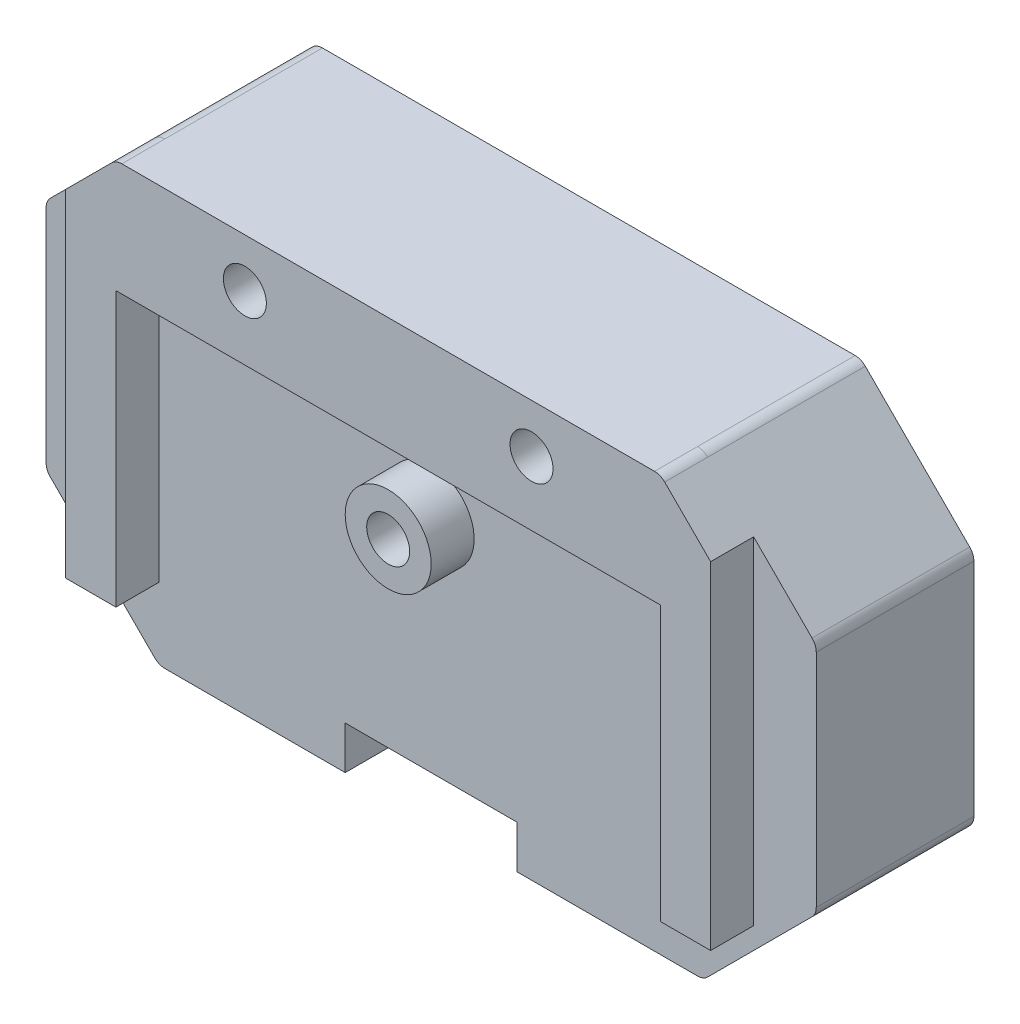
from build123d import *
from build123d.topology import SkipClean

# Parameters (mm, degrees)
CROQUIS3_W                   = 38
CROQUIS3_H                   = 38
SALIENTE_EXTRUIR9_DEPTH      = 1
SALIENTE_EXTRUIR10_START     = -11
SALIENTE_EXTRUIR10_OUTLINE_W = 38
SALIENTE_EXTRUIR10_OUTLINE_H = 38
SALIENTE_EXTRUIR10_DEPTH     = 10
CROQUIS13_W                  = 38
CROQUIS13_H                  = 38
SALIENTE_EXTRUIR15_DEPTH     = 3
CROQUIS14_R                  = 1.5
CORTAR_EXTRUIR1_DEPTH        = 14
CROQUIS15_W                  = 38
CROQUIS15_H                  = 24.129942315
CROQUIS15_R                  = 1.5
CROQUIS15_R_2                = 3.5
SALIENTE_EXTRUIR16_DEPTH     = 1
CORTAR_EXTRUIR2_DEPTH        = 14
CROQUIS17_R                  = 1.5
SALIENTE_EXTRUIR17_DEPTH     = 5
CROQUIS18_R                  = 1.5
CROQUIS18_W                  = 12
CROQUIS18_H                  = 12
SALIENTE_EXTRUIR18_DEPTH     = 5
CORTAR_EXTRUIR3_DEPTH        = 3
CROQUIS20_R                  = 3
CROQUIS20_R_2                = 1.5
SALIENTE_EXTRUIR19_DEPTH     = 3
REDONDEO11_R                 = 1


# Read off the part's stored shape, not the designer's step: Saliente-Extruir10
with BuildPart() as part:
    # Croquis3 → Saliente-Extruir9 (new body)
    with BuildSketch(Plane.XY.offset(5)):
        Polygon((19, -5.370057685), (26.870057685, 2.5), (26.870057685, 40.5), (19, 48.370057685), (-19, 48.370057685), (-26.870057685, 40.5), (-26.870057685, 2.5), (-19, -5.370057685), align=None)
        with Locations((0, 21.5)):
            Rectangle(CROQUIS3_W, CROQUIS3_H, mode=Mode.SUBTRACT)
    extrude(amount=-SALIENTE_EXTRUIR9_DEPTH)

    # Saliente-Extruir10 outline → Saliente-Extruir10 (add)
    with BuildSketch(Plane(origin=(0, 0, 4), x_dir=(-1, 0, 0), z_dir=(0, 0, -1)).offset(SALIENTE_EXTRUIR10_START)):
        Polygon((-26.870057685, 2.5), (-19, -5.370057685), (19, -5.370057685), (26.870057685, 2.5), (26.870057685, 40.5), (19, 48.370057685), (-19, 48.370057685), (-26.870057685, 40.5), align=None)
        with Locations((0, 21.5)):
            Rectangle(SALIENTE_EXTRUIR10_OUTLINE_W, SALIENTE_EXTRUIR10_OUTLINE_H, mode=Mode.SUBTRACT)
    extrude(amount=SALIENTE_EXTRUIR10_DEPTH)

    # Croquis13 → Saliente-Extruir15 (add)
    with BuildSketch(Plane.XY.offset(15)):
        with BuildLine():
            Line((-22.5, 44.870057685), (-22.5, -1))
            Line((-22.5, -1), (22.5, -1))
            Line((22.5, -1), (22.5, 44.870057685))
            Line((22.5, 44.870057685), (19.292893219, 48.077164466))
            ThreePointArc((19.292893219, 48.077164466), (18.96846987, 48.293937218), (18.585786438, 48.370057685))
            Line((18.585786438, 48.370057685), (-18.585786438, 48.370057685))
            ThreePointArc((-18.585786438, 48.370057685), (-18.96846987, 48.293937218), (-19.292893219, 48.077164466))
            Line((-19.292893219, 48.077164466), (-22.5, 44.870057685))
        make_face()
        with Locations((0, 21.5)):
            Rectangle(CROQUIS13_W, CROQUIS13_H, mode=Mode.SUBTRACT)
    extrude(amount=SALIENTE_EXTRUIR15_DEPTH)

    # Croquis14 → Cortar-Extruir1 (cut)
    with BuildSketch(Plane(origin=(0, 0, 4), x_dir=(-1, 0, 0), z_dir=(0, 0, -1))):
        with Locations((10, 44.97415474)):
            Circle(CROQUIS14_R)
        with Locations(Location((-10, 44.97415474, 0), (0, 0, 180))):
            Circle(CROQUIS14_R)
    extrude(amount=-CORTAR_EXTRUIR1_DEPTH, mode=Mode.SUBTRACT)

    # Croquis15 → Saliente-Extruir16 (add)
    with BuildSketch(Plane(origin=(0, 0, 4), x_dir=(-1, 0, 0), z_dir=(0, 0, -1))):
        with Locations((0, 28.435028843)):
            Rectangle(CROQUIS15_W, CROQUIS15_H)
        with Locations((0, 34.97415474)):
            Circle(CROQUIS15_R, mode=Mode.SUBTRACT)
        with Locations((0, 25.370057685)):
            Circle(CROQUIS15_R_2, mode=Mode.SUBTRACT)
    extrude(amount=-SALIENTE_EXTRUIR16_DEPTH)

    # Croquis16 → Cortar-Extruir2 (cut)
    with BuildSketch(Plane(origin=(0, 0, 4), x_dir=(-1, 0, 0), z_dir=(0, 0, -1))):
        Polygon((-19, 2.5), (-19, 16.370057685), (-26.870057685, 24.24011537), (-26.870057685, 2.5), (-19, -5.370057685), (19, -5.370057685), (26.870057685, 2.5), (26.870057685, 24.24011537), (19, 16.370057685), (19, 2.5), align=None)
    extrude(amount=-CORTAR_EXTRUIR2_DEPTH, mode=Mode.SUBTRACT)

    # Croquis17 → Saliente-Extruir17 (add)
    with SkipClean():  # the faces are left unmerged after this step: merging them gives an invalid solid
        with BuildSketch(Plane.XY.offset(5)):
            Polygon((6, 31.370057685), (6, 25.370057685), (6, 19.370057685), (6, 16.370057685), (19, 16.370057685), (19, 40.5), (-19, 40.5), (-19, 16.370057685), (-6, 16.370057685), (-6, 19.370057685), (-6, 31.370057685), align=None)
            with Locations((0, 34.97415474)):
                Circle(CROQUIS17_R, mode=Mode.SUBTRACT)
        extrude(amount=SALIENTE_EXTRUIR17_DEPTH)
    add(part.part.scale(1), mode=Mode.REPLACE)  # the faces are merged on a copy

    # Croquis18 → Saliente-Extruir18 (add)
    # profile 1 of 2: a face of its own
    with BuildSketch(Plane.XY.offset(10)):
        Polygon((-6, 31.370057685), (6, 31.370057685), (6, 16.370057685), (19, 16.370057685), (19, 40.5), (-19, 40.5), (-19, 16.370057685), (-6, 16.370057685), align=None)
        with Locations(Location((0, 34.97415474, 0), (0, 0, 180))):
            Circle(CROQUIS18_R, mode=Mode.SUBTRACT)
    # profile 2 of 2: a face of its own
    with BuildSketch(Plane.XY.offset(10)):
        with Locations((0, 25.370057685)):
            Rectangle(CROQUIS18_W, CROQUIS18_H)
    extrude(amount=SALIENTE_EXTRUIR18_DEPTH)

    # Croquis19 → Cortar-Extruir3 (cut)
    with BuildSketch(Plane.XY.offset(18)):
        Polygon((-22.5, 19.870057685), (-19, 16.370057685), (-19, 21.370057685), (-22.5, 21.370057685), align=None)
        Polygon((19, 16.370057685), (22.5, 19.870057685), (22.5, 21.370057685), (19, 21.370057685), align=None)
    extrude(amount=-CORTAR_EXTRUIR3_DEPTH, mode=Mode.SUBTRACT)

    # Croquis20 → Saliente-Extruir19 (add)
    with BuildSketch(Plane.XY.offset(15)):
        with Locations(Location((0, 34.97415474, 0), (0, 0, 180))):
            Circle(CROQUIS20_R)
        with Locations(Location((0, 34.97415474, 0), (0, 0, 180))):
            Circle(CROQUIS20_R_2, mode=Mode.SUBTRACT)
    extrude(amount=SALIENTE_EXTRUIR19_DEPTH)

    # Redondeo11
    redondeo11_edges = [part.edges().sort_by_distance(p)[0] for p in [
        (26.870057685, 40.5, 10),
        (19, 48.370057685, 10),
        (-19, 48.370057685, 10),
        (-26.870057685, 40.5, 10),
        (26.870057685, 24.24011537, 9.5),
        (19, 16.370057685, 9.5),
        (-26.870057685, 24.24011537, 9.5),
        (-19, 16.370057685, 9.5),
    ]]
    fillet(redondeo11_edges, radius=REDONDEO11_R)


solid = part.part
